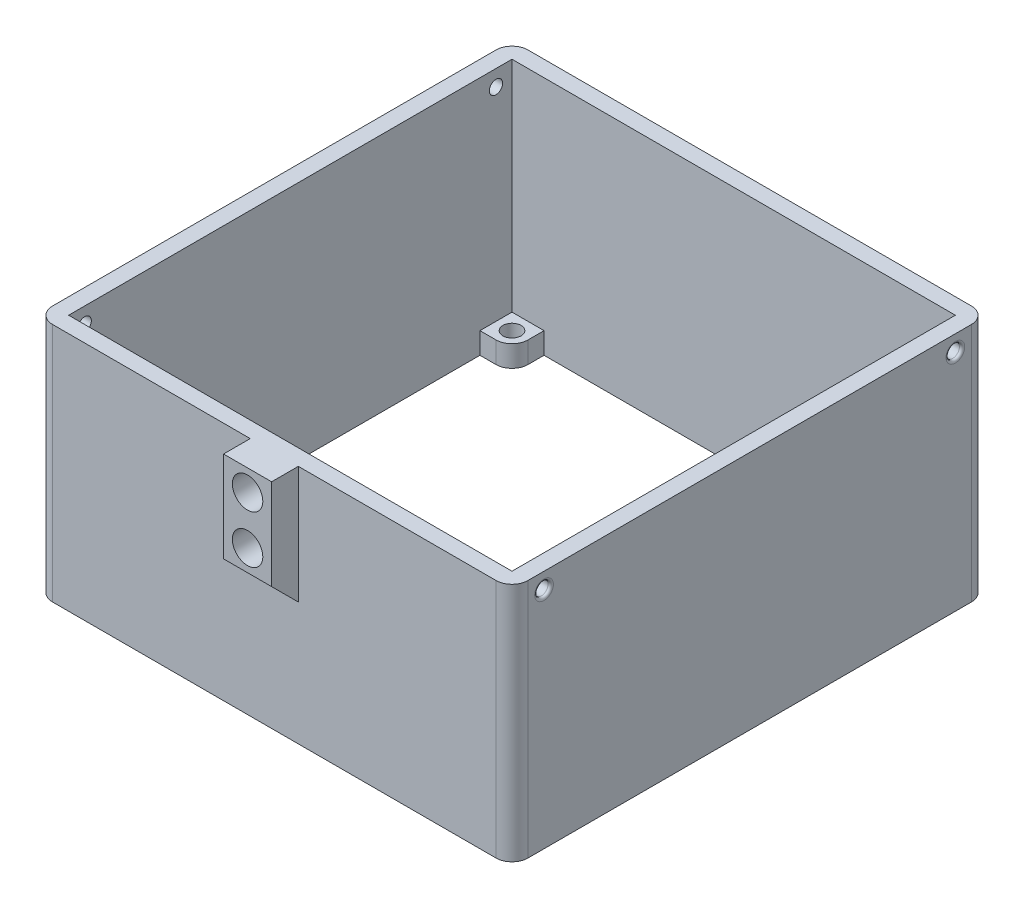
from build123d import *

# Parameters (mm, degrees)
SKETCH1_W           = 89
SKETCH1_H           = 89
SKETCH1_W_2         = 83
SKETCH1_H_2         = 83
BOSS_EXTRUDE1_DEPTH = 22.5
SKETCH4_W           = 6
SKETCH4_H           = 6
SKETCH4_R           = 1.7
BOSS_EXTRUDE3_DEPTH = 4
FILLET3_R           = 3
SKETCH6_W           = 9
SKETCH6_H           = 17
SKETCH6_R           = 2.85
BOSS_EXTRUDE4_DEPTH = 5
CHAMFER1_SIZE       = 5
FILLET4_R           = 3
SKETCH7_R           = 1.25
CUT_EXTRUDE1_DEPTH  = 128.860275301
FILLET5_R           = 0.5


with BuildPart() as part:
    # Sketch1 → Boss-Extrude1 (new, symmetric)
    with BuildSketch(Plane(origin=(0, 0, 0), x_dir=(1, 0, 0), z_dir=(0, 1, 0))):
        with Locations((44.5, 44.5)):
            Rectangle(SKETCH1_W, SKETCH1_H)
        with Locations((44.5, 44.5)):
            Rectangle(SKETCH1_W_2, SKETCH1_H_2, mode=Mode.SUBTRACT)
    extrude(amount=BOSS_EXTRUDE1_DEPTH, both=True)

    # Sketch4 → Boss-Extrude3 (add)
    # profile 1 of 4: a face of its own
    with BuildSketch(Plane.XZ.offset(22.5)):
        with Locations((83, -6)):
            Rectangle(SKETCH4_W, SKETCH4_H)
        with Locations(Location((83, -6, 0), (0, 0, 270))):
            Circle(SKETCH4_R, mode=Mode.SUBTRACT)
    # profile 2 of 4: a face of its own
    with BuildSketch(Plane.XZ.offset(22.5)):
        with Locations((6, -6)):
            Rectangle(SKETCH4_W, SKETCH4_H)
        with Locations(Location((6, -6, 0), (0, 0, 270))):
            Circle(SKETCH4_R, mode=Mode.SUBTRACT)
    # profile 3 of 4: a face of its own
    with BuildSketch(Plane.XZ.offset(22.5)):
        with Locations((83, -83)):
            Rectangle(SKETCH4_W, SKETCH4_H)
        with Locations(Location((83, -83, 0), (0, 0, 270))):
            Circle(SKETCH4_R, mode=Mode.SUBTRACT)
    # profile 4 of 4: a face of its own
    with BuildSketch(Plane.XZ.offset(22.5)):
        with Locations((6, -83)):
            Rectangle(SKETCH4_W, SKETCH4_H)
        with Locations(Location((6, -83, 0), (0, 0, 270))):
            Circle(SKETCH4_R, mode=Mode.SUBTRACT)
    extrude(amount=-BOSS_EXTRUDE3_DEPTH)

    # Fillet3
    fillet3_edges = [part.edges().sort_by_distance(p)[0] for p in [
        (9, -20.5, -9),
        (80, -20.5, -9),
        (9, -20.5, -80),
        (80, -20.5, -80),
    ]]
    fillet(fillet3_edges, radius=FILLET3_R)

    # Sketch6 → Boss-Extrude4 (add)
    with BuildSketch(Plane.XY):
        with Locations((44.5, 14)):
            Rectangle(SKETCH6_W, SKETCH6_H)
        with Locations((44.5, 18.5)):
            Circle(SKETCH6_R, mode=Mode.SUBTRACT)
        with Locations((44.5, 9.5)):
            Circle(SKETCH6_R, mode=Mode.SUBTRACT)
    extrude(amount=BOSS_EXTRUDE4_DEPTH)

    # Chamfer1
    chamfer1_edges = [part.edges().sort_by_distance(p)[0] for p in [
        (44.5, 5.5, 0),
    ]]
    chamfer(chamfer1_edges, length=CHAMFER1_SIZE - 0.0001)  # a hair under: the kernel refuses the full size

    # Fillet4
    fillet4_edges = [part.edges().sort_by_distance(p)[0] for p in [
        (0, 0, -89),
        (89, 0, -89),
        (89, 0, 0),
        (0, 0, 0),
    ]]
    fillet(fillet4_edges, radius=FILLET4_R)

    # Sketch7 → Cut-Extrude1 (cut, through all)
    with BuildSketch(Plane(origin=(89, 0, 0), x_dir=(0, 0, -1), z_dir=(1, 0, 0))):
        with Locations((83, 19.5)):
            Circle(SKETCH7_R)
        with Locations((6, 19.5)):
            Circle(SKETCH7_R)
    extrude(amount=-CUT_EXTRUDE1_DEPTH, mode=Mode.SUBTRACT)

    # Fillet5
    fillet5_edges = [part.edges().sort_by_distance(p)[0] for p in [
        (0, 19.5, -81.75),
        (89, 19.5, -81.75),
        (0, 19.5, -4.75),
        (89, 19.5, -4.75),
    ]]
    fillet(fillet5_edges, radius=FILLET5_R)


solid = part.part
